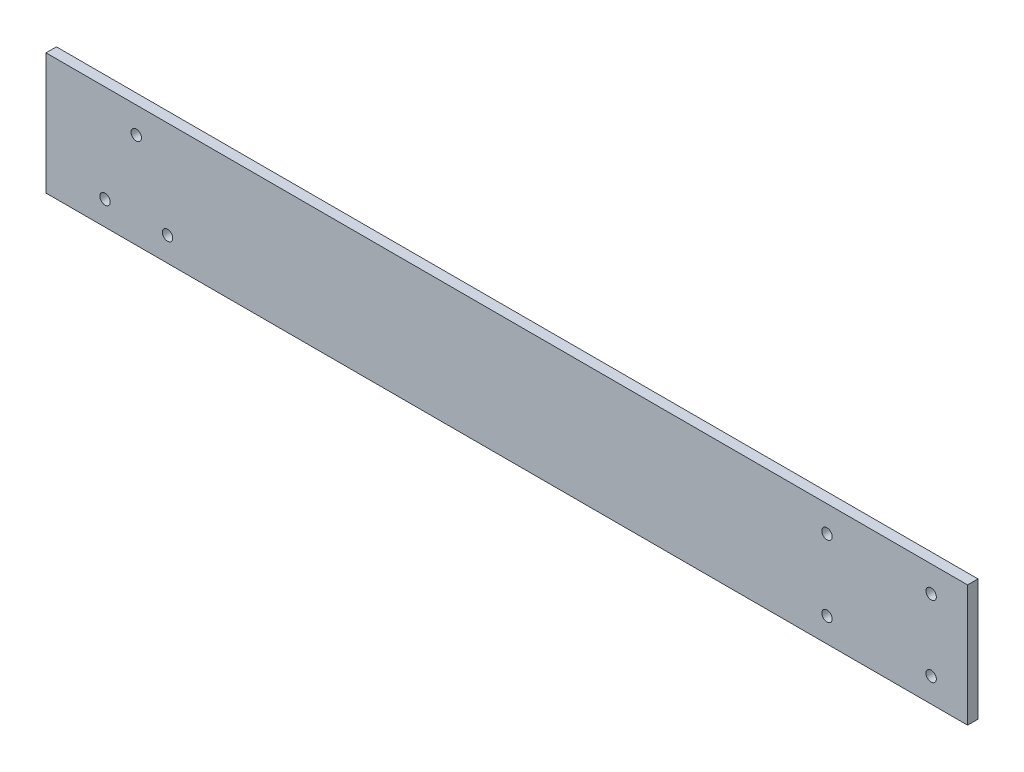
from build123d import *

# Parameters (mm, degrees)
CROQUIS1_W              = 265.5
CROQUIS1_H              = 35
CROQUIS1_R              = 1.5
SALIENTE_EXTRUIR1_DEPTH = 3


with BuildPart() as part:
    # Croquis1 → Saliente-Extruir1 (new body)
    with BuildSketch(Plane.XY):
        Rectangle(CROQUIS1_W, CROQUIS1_H)
        with Locations((-115.75, -10.5)):
            Circle(CROQUIS1_R, mode=Mode.SUBTRACT)
        with Locations((-97.75, -10.5)):
            Circle(CROQUIS1_R, mode=Mode.SUBTRACT)
        with Locations((-106.75, 10)):
            Circle(CROQUIS1_R, mode=Mode.SUBTRACT)
        with Locations((122.25, 10)):
            Circle(CROQUIS1_R, mode=Mode.SUBTRACT)
        with Locations((92.25, 10)):
            Circle(CROQUIS1_R, mode=Mode.SUBTRACT)
        with Locations((92.25, -10.5)):
            Circle(CROQUIS1_R, mode=Mode.SUBTRACT)
        with Locations((122.25, -10.5)):
            Circle(CROQUIS1_R, mode=Mode.SUBTRACT)
    extrude(amount=SALIENTE_EXTRUIR1_DEPTH)


solid = part.part
